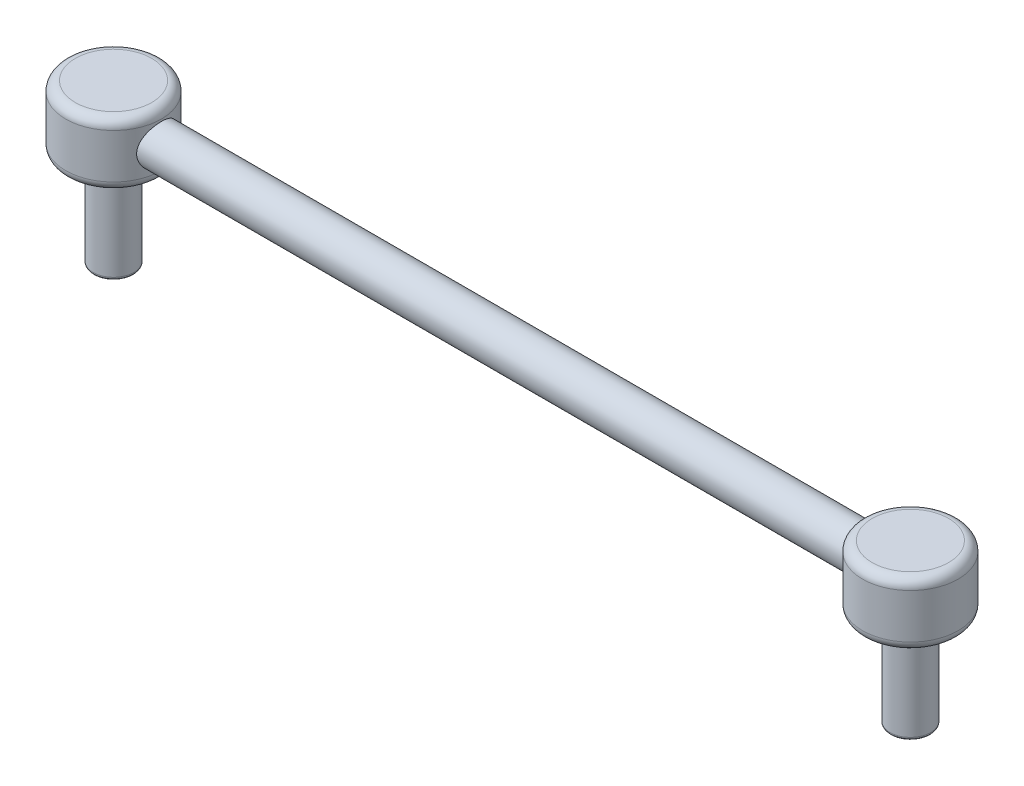
from build123d import *

# Parameters (mm, degrees)
SKETCH1_R           = 6.35
BOSS_EXTRUDE1_DEPTH = 30
SKETCH2_R           = 15
BOSS_EXTRUDE2_DEPTH = 20
SKETCH4_R           = 6.35
BOSS_EXTRUDE3_DEPTH = 30
SKETCH5_R           = 15
BOSS_EXTRUDE4_DEPTH = 20
SKETCH6_R           = 6.35
BOSS_EXTRUDE5_DEPTH = 250
FILLET1_R           = 3
FILLET2_R           = 1


with BuildPart() as part:
    # Sketch1 → Boss-Extrude1 (new body)
    with BuildSketch(Plane(origin=(0, 0, 0), x_dir=(1, 0, 0), z_dir=(0, 1, 0))):
        Circle(SKETCH1_R)
    extrude(amount=-BOSS_EXTRUDE1_DEPTH)

    # Sketch2 → Boss-Extrude2 (add)
    with BuildSketch(Plane(origin=(0, 0, 0), x_dir=(1, 0, 0), z_dir=(0, 1, 0))):
        Circle(SKETCH2_R)
    extrude(amount=BOSS_EXTRUDE2_DEPTH)



with BuildPart() as body_2:
    # Sketch4 → Boss-Extrude3 (new body)
    with BuildSketch(Plane(origin=(0, 0, 0), x_dir=(1, 0, 0), z_dir=(0, 1, 0))):
        with Locations((250, 0)):
            Circle(SKETCH4_R)
    extrude(amount=-BOSS_EXTRUDE3_DEPTH)

    # Sketch5 → Boss-Extrude4 (add)
    with BuildSketch(Plane(origin=(0, 0, 0), x_dir=(1, 0, 0), z_dir=(0, 1, 0))):
        with Locations((250, 0)):
            Circle(SKETCH5_R)
    extrude(amount=BOSS_EXTRUDE4_DEPTH)


with BuildPart() as part_1:
    add(part.part)

    add(body_2.part)  # Boss-Extrude5 merges body 2
    # Sketch6 → Boss-Extrude5 (add)
    with BuildSketch(Plane(origin=(0, 0, 0), x_dir=(0, 0, -1), z_dir=(1, 0, 0))):
        with Locations((0, 10)):
            Circle(SKETCH6_R)
    extrude(amount=BOSS_EXTRUDE5_DEPTH)

    # Fillet1
    fillet1_edges = [part_1.edges().sort_by_distance(p)[0] for p in [
        (235, 0, 0),
        (-15, 0, 0),
        (-15, 20, 0),
        (235, 20, 0),
    ]]
    fillet(fillet1_edges, radius=FILLET1_R)

    # Fillet2
    fillet2_edges = [part_1.edges().sort_by_distance(p)[0] for p in [
        (243.65, -30, 0),
        (-6.35, -30, 0),
    ]]
    fillet(fillet2_edges, radius=FILLET2_R)


solid = part_1.part
